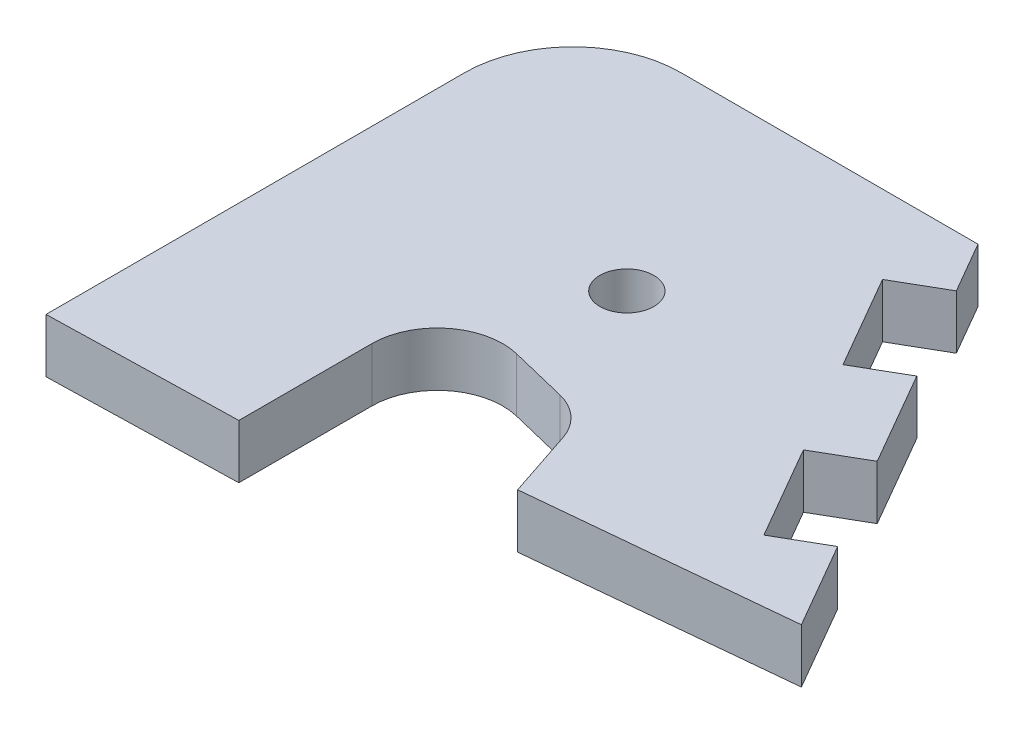
from build123d import *

# Parameters (mm, degrees)
SKETCH1_R           = 5
BOSS_EXTRUDE1_DEPTH = 10


# Read off the part's stored shape, not the designer's step: Imported1
with BuildPart() as part:
    # Sketch1 → Boss-Extrude1 (new body)
    with BuildSketch(Plane(origin=(0, 0, 0), x_dir=(1, 0, 0), z_dir=(0, 1, 0))):
        with BuildLine():
            Line((-30, 40), (25, 40))
            Line((25, 40), (30.478825766, 30.510395408))
            Line((30.478825766, 30.510395408), (21.818571728, 25.510395408))
            Line((21.818571728, 25.510395408), (31.818571728, 8.189887333))
            Line((31.818571728, 8.189887333), (40.478825766, 13.189887333))
            Line((40.478825766, 13.189887333), (50.478825766, -4.130620743))
            Line((50.478825766, -4.130620743), (41.818571728, -9.130620743))
            Line((41.818571728, -9.130620743), (51.818571728, -26.451128819))
            Line((51.818571728, -26.451128819), (60.478825766, -21.451128819))
            Line((60.478825766, -21.451128819), (69.659283069, -37.352147305))
            Line((69.659283069, -37.352147305), (21.766908157, -41.979610283))
            Line((21.766908157, -41.979610283), (19.644977926, -35.595148029))
            Line((19.644977926, -35.595148029), (17.593976856, -29.424097387))
            ThreePointArc((17.593976856, -29.424097387), (14.880225334, -25.223606168), (10.471929596, -22.862355971))
            Line((10.471929596, -22.862355971), (-0.170430849, -20.268984513))
            ThreePointArc((-0.170430849, -20.268984513), (-10.525131482, -22.513169462), (-15.157047212, -32.042154085))
            Line((-15.157047212, -32.042154085), (-15.157047212, -56.665547585))
            Line((-15.157047212, -56.665547585), (-50, -57.51739948))
            Line((-50, -57.51739948), (-50, -33.474160509))
            Line((-50, -33.474160509), (-50, 20))
            ThreePointArc((-50, 20), (-44.142135624, 34.142135624), (-30, 40))
        make_face()
        with Locations(Location((0, 0, 0), (0, 0, 90))):
            Circle(SKETCH1_R, mode=Mode.SUBTRACT)
    extrude(amount=BOSS_EXTRUDE1_DEPTH)


solid = part.part
